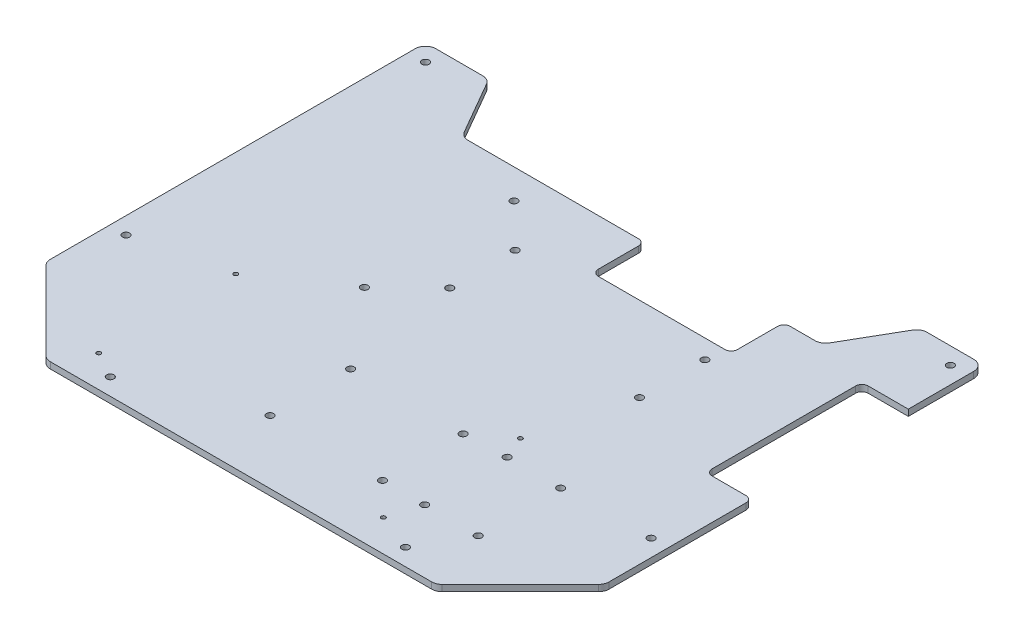
from build123d import *

# Parameters (mm, degrees)
BOSS_EXTRU_1_DEPTH           = 3
CONG_1_R                     = 5
ESQUISSE2_R                  = 1
ENL_V_MAT_EXTRU_1_DEPTH      = 3
D_GAGEMENT_M31_D             = 3.4
ESQUISSE5_W                  = 66
ESQUISSE5_H                  = 25
ESQUISSE5_W_2                = 22
ESQUISSE5_H_2                = 74
ENL_V_MAT_EXTRU_2_DEPTH      = 257.837010573
CONG_2_R                     = 3
ESQUISSE6_R                  = 1
ENL_V_MAT_EXTRU_3_DEPTH      = 257.837010573
D_GAGEMENT_M32_D             = 3.4
D_GAGEMENT_M32_DEPTH         = 10
D_GAGEMENT_M32_TIP           = 1.021463052
ESQUISSE9_R                  = 1
ENL_V_MAT_EXTRU_4_DEPTH      = 257.837010573
D_GAGEMENT_M33_D             = 3.4
D_GAGEMENT_M33_DEPTH         = 10
D_GAGEMENT_M33_TIP           = 1.021463052
ENL_V_MAT_EXTRU_5_DEPTH      = 257.837010573
ENL_V_MAT_EXTRU_5_DEPTH_BACK = 257.837010573
ESQUISSE12_R                 = 1
D_GAGEMENT_M34_D             = 3.4
D_GAGEMENT_M34_DEPTH         = 10
D_GAGEMENT_M34_TIP           = 1.021463052


with BuildPart() as part:
    # Esquisse1 → Boss.-Extru.1 (new body)
    with BuildSketch(Plane(origin=(0, 0, 0), x_dir=(1, 0, 0), z_dir=(0, 1, 0))):
        Polygon((-92.5, 0), (92.5, 0), (132.5, 40), (132.5, 220), (102.5, 220), (85.179491924, 190), (-85.179491924, 190), (-102.5, 220), (-132.5, 220), (-132.5, 40), align=None)
    extrude(amount=BOSS_EXTRU_1_DEPTH)

    # Congé1
    cong_1_edges = [part.edges().sort_by_distance(p)[0] for p in [
        (92.5, 1.5, 0),
        (132.5, 1.5, -40),
        (132.5, 1.5, -220),
        (102.5, 1.5, -220),
        (85.179491924, 1.5, -190),
        (-85.179491924, 1.5, -190),
        (-102.5, 1.5, -220),
        (-132.5, 1.5, -220),
        (-92.5, 1.5, 0),
        (-132.5, 1.5, -40),
    ]]
    fillet(cong_1_edges, radius=CONG_1_R)

    # Esquisse2 → Enlèv. mat.-Extru.1 (cut)
    with BuildSketch(Plane(origin=(0, 3, 0), x_dir=(1, 0, 0), z_dir=(0, 1, 0))):
        with Locations((70, 8)):
            Circle(ESQUISSE2_R)
        with Locations((124.5, 70)):
            Circle(ESQUISSE2_R)
        with Locations((124.5, 212)):
            Circle(ESQUISSE2_R)
        with Locations((-124.5, 212)):
            Circle(ESQUISSE2_R)
        with Locations((-124.5, 70)):
            Circle(ESQUISSE2_R)
        with Locations((-70, 8)):
            Circle(ESQUISSE2_R)
    extrude(amount=-ENL_V_MAT_EXTRU_1_DEPTH, mode=Mode.SUBTRACT)

    # Dégagement M31 (through all)
    with Locations(Plane(origin=(0, 3, 0), x_dir=(1, 0, 0), z_dir=(0, 1, 0))):
        with Locations((70, 8), (-70, 8), (-124.5, 70), (-124.5, 212), (124.5, 212), (124.5, 70)):
            Hole(D_GAGEMENT_M31_D / 2)

    # Esquisse5 → Enlèv. mat.-Extru.2 (cut, through all)
    with BuildSketch(Plane(origin=(0, 3, 0), x_dir=(1, 0, 0), z_dir=(0, 1, 0))):
        with Locations((34.5, 177.5)):
            Rectangle(ESQUISSE5_W, ESQUISSE5_H)
        with Locations((121.5, 147)):
            Rectangle(ESQUISSE5_W_2, ESQUISSE5_H_2)
    extrude(amount=-ENL_V_MAT_EXTRU_2_DEPTH, mode=Mode.SUBTRACT)

    # Congé2
    cong_2_edges = [part.edges().sort_by_distance(p)[0] for p in [
        (132.5, 1.5, -110),
        (110.5, 1.5, -110),
        (110.5, 1.5, -184),
        (67.5, 1.5, -190),
        (67.5, 1.5, -165),
        (1.5, 1.5, -165),
        (1.5, 1.5, -190),
    ]]
    fillet(cong_2_edges, radius=CONG_2_R)

    # Esquisse6 → Enlèv. mat.-Extru.3 (cut, through all)
    with BuildSketch(Plane(origin=(0, 3, 0), x_dir=(1, 0, 0), z_dir=(0, 1, 0))):
        with Locations((64, 156)):
            Circle(ESQUISSE6_R)
        with Locations((-26, 156)):
            Circle(ESQUISSE6_R)
        with Locations((-46.5, 176)):
            Circle(ESQUISSE6_R)
        with Locations((64, 125)):
            Circle(ESQUISSE6_R)
        with Locations((-26, 125)):
            Circle(ESQUISSE6_R)
        with Locations((-46.5, 105)):
            Circle(ESQUISSE6_R)
    extrude(amount=-ENL_V_MAT_EXTRU_3_DEPTH, mode=Mode.SUBTRACT)

    # Dégagement M32
    with Locations(Plane(origin=(0, 3, 0), x_dir=(1, 0, 0), z_dir=(0, 1, 0))):
        with Locations((-46.5, 105), (-26, 125), (-26, 156), (-46.5, 176), (64, 156), (64, 125)):
            Hole(D_GAGEMENT_M32_D / 2, depth=D_GAGEMENT_M32_DEPTH)
            with Locations((0, 0, -(D_GAGEMENT_M32_DEPTH + D_GAGEMENT_M32_TIP / 2))):  # 118° drill point
                Cone(0, D_GAGEMENT_M32_D / 2, D_GAGEMENT_M32_TIP, mode=Mode.SUBTRACT)

    # Esquisse9 → Enlèv. mat.-Extru.4 (cut, through all)
    with BuildSketch(Plane(origin=(0, 3, 0), x_dir=(1, 0, 0), z_dir=(0, 1, 0))):
        with Locations((82.5, 30)):
            Circle(ESQUISSE9_R)
        with Locations((57.1, 30)):
            Circle(ESQUISSE9_R)
        with Locations((57.1, 69.12)):
            Circle(ESQUISSE9_R)
        with Locations((82.5, 69.12)):
            Circle(ESQUISSE9_R)
        with Locations((-16.24, 68.24)):
            Circle(ESQUISSE9_R)
        with Locations((37.1, 68.24)):
            Circle(ESQUISSE9_R)
        with Locations((37.1, 30)):
            Circle(ESQUISSE9_R)
        with Locations((-16.24, 30)):
            Circle(ESQUISSE9_R)
    extrude(amount=-ENL_V_MAT_EXTRU_4_DEPTH, mode=Mode.SUBTRACT)

    # Dégagement M33
    with Locations(Plane(origin=(0, 3, 0), x_dir=(1, 0, 0), z_dir=(0, 1, 0))):
        with Locations((57.1, 30), (82.5, 30), (57.1, 69.12), (82.5, 69.12)):
            Hole(D_GAGEMENT_M33_D / 2, depth=D_GAGEMENT_M33_DEPTH)
            with Locations((0, 0, -(D_GAGEMENT_M33_DEPTH + D_GAGEMENT_M33_TIP / 2))):  # 118° drill point
                Cone(0, D_GAGEMENT_M33_D / 2, D_GAGEMENT_M33_TIP, mode=Mode.SUBTRACT)

    # Esquisse12 → Enlèv. mat.-Extru.5 (cut, two sides: drawn at the far end of the back side and taken through both)
    with BuildSketch(Plane(origin=(0, 3, 0), x_dir=(1, 0, 0), z_dir=(0, 1, 0)).offset(-ENL_V_MAT_EXTRU_5_DEPTH_BACK)):
        with Locations((52.5, 15)):
            Circle(ESQUISSE12_R)
        with Locations((52.5, 80)):
            Circle(ESQUISSE12_R)
        with Locations((-82.5, 80)):
            Circle(ESQUISSE12_R)
        with Locations((-82.5, 15)):
            Circle(ESQUISSE12_R)
    extrude(amount=ENL_V_MAT_EXTRU_5_DEPTH + ENL_V_MAT_EXTRU_5_DEPTH_BACK, mode=Mode.SUBTRACT)

    # Dégagement M34
    with Locations(Plane(origin=(0, 3, 0), x_dir=(1, 0, 0), z_dir=(0, 1, 0))):
        with Locations((-16.24, 68.24), (-16.24, 30), (37.1, 30), (37.1, 68.24)):
            Hole(D_GAGEMENT_M34_D / 2, depth=D_GAGEMENT_M34_DEPTH)
            with Locations((0, 0, -(D_GAGEMENT_M34_DEPTH + D_GAGEMENT_M34_TIP / 2))):  # 118° drill point
                Cone(0, D_GAGEMENT_M34_D / 2, D_GAGEMENT_M34_TIP, mode=Mode.SUBTRACT)


solid = part.part
